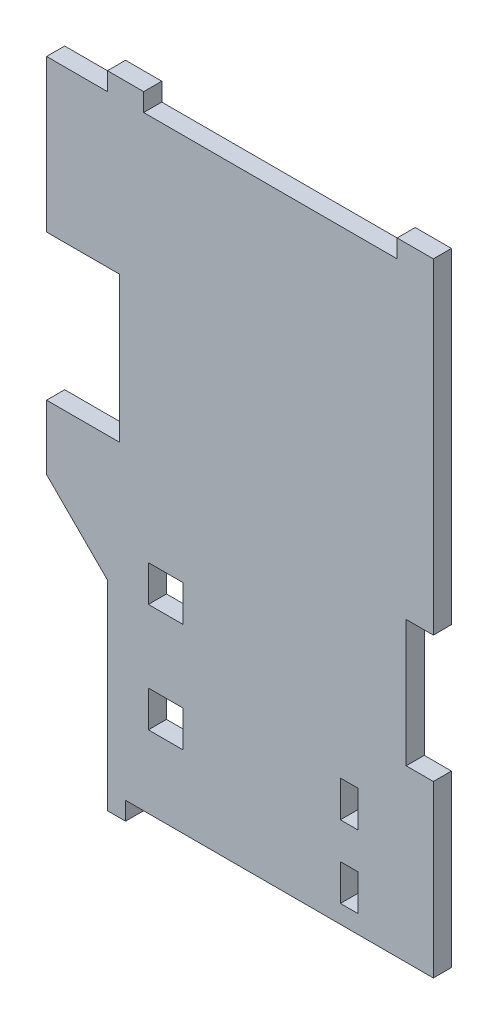
from build123d import *

# Parameters (mm, degrees)
ESQUISSE1_W             = 4.807532778
ESQUISSE1_H             = 10
ESQUISSE1_W_2           = 9.57980661
BOSS_EXTRU_1_DEPTH      = 5
BOSS_EXTRU_2_DEPTH      = 5
ESQUISSE3_W             = 20.2
ESQUISSE3_H             = 40.2
ENL_V_MAT_EXTRU_1_DEPTH = 5


with BuildPart() as part:
    # Esquisse1 → Boss.-Extru.1 (new body)
    with BuildSketch(Plane.XY):
        Polygon((90, 82), (90, 167), (90, 172), (80, 172), (80, 167), (10, 167), (10, 172), (0, 172), (0, 167), (0, 0), (0, -5), (5, -5), (5, 0), (90, 0), (90, 47), (82.5, 47), (82.5, 82), align=None)
        with Locations((66.738521132, 30)):
            Rectangle(ESQUISSE1_W, ESQUISSE1_H, mode=Mode.SUBTRACT)
        with Locations((66.738521132, 10)):
            Rectangle(ESQUISSE1_W, ESQUISSE1_H, mode=Mode.SUBTRACT)
        with Locations((16.093272864, 25)):
            Rectangle(ESQUISSE1_W_2, ESQUISSE1_H, mode=Mode.SUBTRACT)
        with Locations((16.093272864, 55)):
            Rectangle(ESQUISSE1_W_2, ESQUISSE1_H, mode=Mode.SUBTRACT)
    extrude(amount=BOSS_EXTRU_1_DEPTH)

    # Esquisse2 → Boss.-Extru.2 (add)
    with BuildSketch(Plane.XY.offset(5)):
        Polygon((0, 167), (-16.814476947, 167), (-16.814476947, 67), (0, 50.185523053), align=None)
    extrude(amount=-BOSS_EXTRU_2_DEPTH)

    # Esquisse3 → Enlèv. mat.-Extru.1 (cut)
    with BuildSketch(Plane.XY.offset(5)):
        with Locations((-6.714476947, 104.9)):
            Rectangle(ESQUISSE3_W, ESQUISSE3_H)
    extrude(amount=-ENL_V_MAT_EXTRU_1_DEPTH, mode=Mode.SUBTRACT)


solid = part.part
